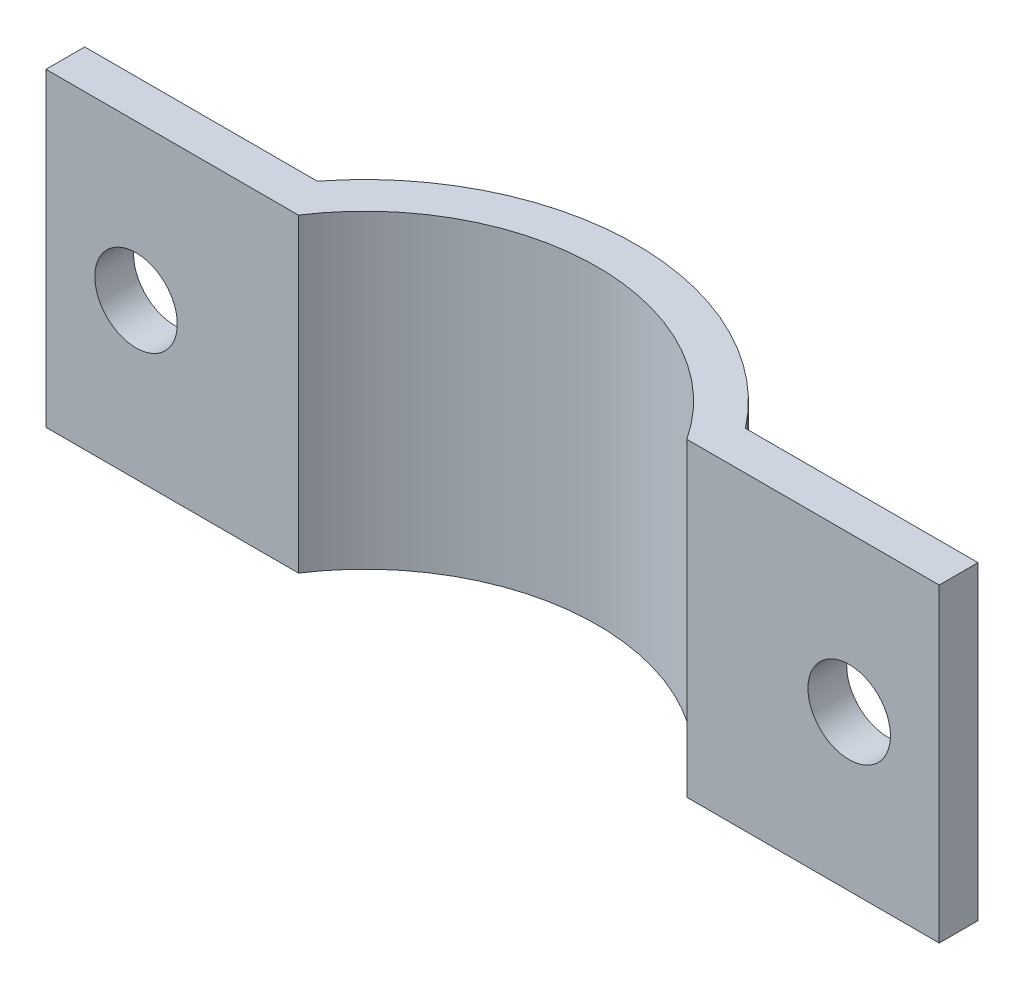
from build123d import *

# Parameters (mm, degrees)
SKETCH1_R           = 19.05
BOSS_EXTRUDE1_DEPTH = 25.4
SKETCH2_R           = 3.3782
CUT_EXTRUDE1_DEPTH  = 58.192584653
SKETCH3_W           = 85.242997218
SKETCH3_H           = 34.152222548
CUT_EXTRUDE2_DEPTH  = 50.776976184


with BuildPart() as part:
    # Sketch1 → Boss-Extrude1 (new body)
    with BuildSketch(Plane(origin=(0, 0, 0), x_dir=(1, 0, 0), z_dir=(0, 1, 0))):
        with BuildLine():
            Line((36.587384889, 13.6525), (17.537384889, 13.6525))
            ThreePointArc((17.537384889, 13.6525), (0, 22.225), (-17.537384889, 13.6525))
            Line((-17.537384889, 13.6525), (-36.587384889, 13.6525))
            Line((-36.587384889, 13.6525), (-36.587384889, 4.1275))
            Line((-36.587384889, 4.1275), (-21.838369187, 4.1275))
            ThreePointArc((-21.838369187, 4.1275), (0, -22.225), (21.838369187, 4.1275))
            Line((21.838369187, 4.1275), (36.587384889, 4.1275))
            Line((36.587384889, 4.1275), (36.587384889, 13.6525))
        make_face()
        Circle(SKETCH1_R, mode=Mode.SUBTRACT)
    extrude(amount=BOSS_EXTRUDE1_DEPTH)

    # Sketch2 → Cut-Extrude1 (cut, through all)
    with BuildSketch(Plane(origin=(0, 0, -13.6525), x_dir=(-1, 0, 0), z_dir=(0, 0, -1))):
        with Locations((29.21, 12.7)):
            Circle(SKETCH2_R)
        with Locations((-29.21, 12.7)):
            Circle(SKETCH2_R)
    extrude(amount=-CUT_EXTRUDE1_DEPTH, mode=Mode.SUBTRACT)

    # Sketch3 → Cut-Extrude2 (cut, through all)
    with BuildSketch(Plane(origin=(0, 25.4, 0), x_dir=(1, 0, 0), z_dir=(0, 1, 0))):
        with Locations((-0.146640147, -6.598611274)):
            Rectangle(SKETCH3_W, SKETCH3_H)
    extrude(amount=-CUT_EXTRUDE2_DEPTH, mode=Mode.SUBTRACT)


solid = part.part
